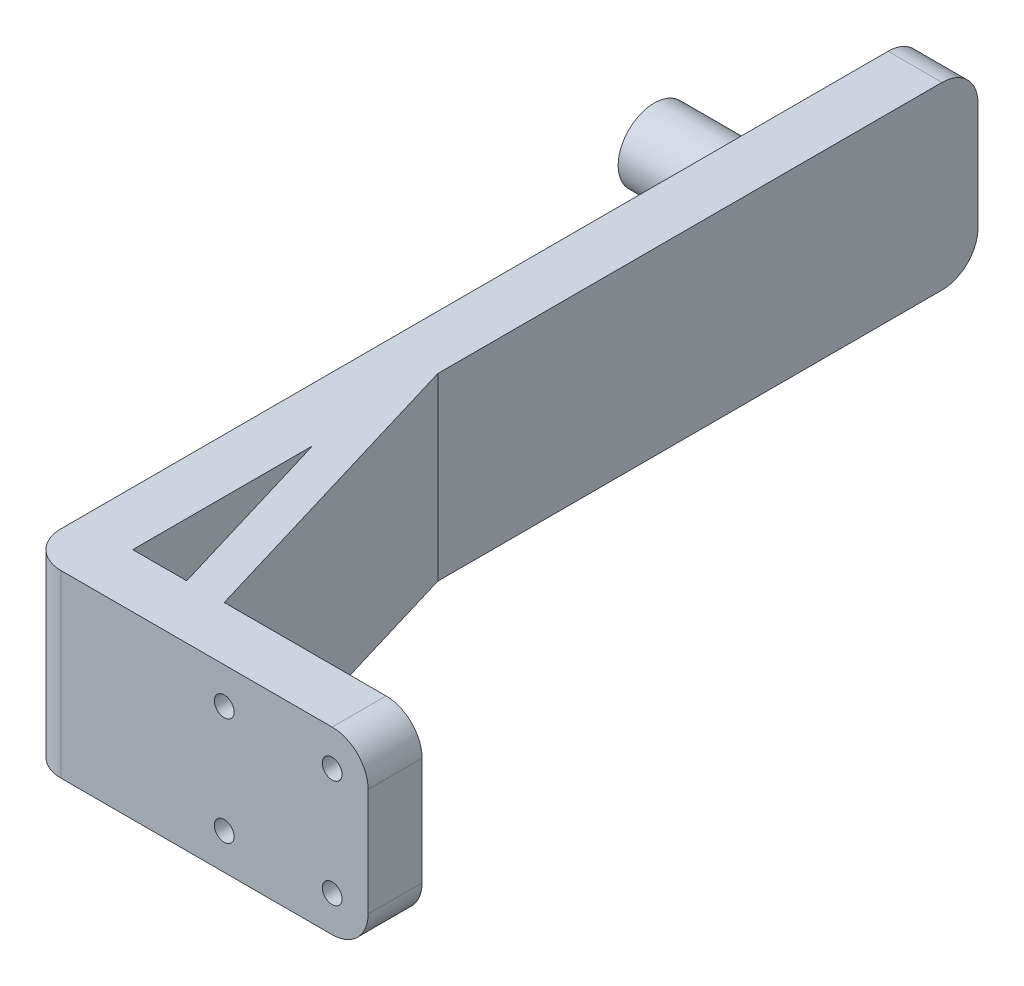
from build123d import *

# Parameters (mm, degrees)
BOSS_EXTRUDE1_DEPTH = 50
FILLET2_R           = 10
SKETCH18_R          = 12.5
BOSS_EXTRUDE2_DEPTH = 5
SKETCH19_R          = 10.05
BOSS_EXTRUDE3_DEPTH = 30
FILLET1_R           = 10


# Read off the part's stored shape, not the designer's step: M5 Clearance Hole3
with BuildPart() as part:
    # Sketch1 → Boss-Extrude1 (new body)
    with BuildSketch(Plane(origin=(0, 0, 0), x_dir=(1, 0, 0), z_dir=(0, 1, 0))):
        Polygon((15, 15), (15, 250), (0, 250), (0, 0), (95.440306509, 0), (95.440306509, 15), align=None)
        Polygon((40.440306509, 15), (15, 99.801021696), (15, 65), (30, 15), align=None)
    extrude(amount=BOSS_EXTRUDE1_DEPTH)

    # Fillet2
    fillet2_edges = [part.edges().sort_by_distance(p)[0] for p in [
        (0, 25, 0),
    ]]
    fillet(fillet2_edges, radius=FILLET2_R)

    # M5 Clearance Hole3 outline → M5 Clearance Hole3 (revolve, cut)
    with BuildSketch(Plane(origin=(55.440306509, 40, 0), x_dir=(1, 0, 0), z_dir=(0, -1, 0))):
        Polygon((2.75, -14.975), (2.75, 0), (0, 0), (0, -15), (2.775, -15), align=None)
    revolve(axis=Axis((55.440306509, 40, 0), (0, 0, 1)), mode=Mode.SUBTRACT)

    # M5 Clearance Hole3 2 outline → M5 Clearance Hole3 2 (revolve, cut)
    with BuildSketch(Plane(origin=(85.440306509, 10, 0), x_dir=(1, 0, 0), z_dir=(0, -1, 0))):
        Polygon((2.75, -14.975), (2.75, 0), (0, 0), (0, -15), (2.775, -15), align=None)
    revolve(axis=Axis((85.440306509, 10, 0), (0, 0, 1)), mode=Mode.SUBTRACT)

    # M5 Clearance Hole3 3 outline → M5 Clearance Hole3 3 (revolve, cut)
    with BuildSketch(Plane(origin=(55.440306509, 10, 0), x_dir=(1, 0, 0), z_dir=(0, -1, 0))):
        Polygon((2.75, -14.975), (2.75, 0), (0, 0), (0, -15), (2.775, -15), align=None)
    revolve(axis=Axis((55.440306509, 10, 0), (0, 0, 1)), mode=Mode.SUBTRACT)

    # M5 Clearance Hole3 4 outline → M5 Clearance Hole3 4 (revolve, cut)
    with BuildSketch(Plane(origin=(85.440306509, 40, 0), x_dir=(1, 0, 0), z_dir=(0, -1, 0))):
        Polygon((2.75, -14.975), (2.75, 0), (0, 0), (0, -15), (2.775, -15), align=None)
    revolve(axis=Axis((85.440306509, 40, 0), (0, 0, 1)), mode=Mode.SUBTRACT)

    # Sketch18 → Boss-Extrude2 (add)
    with BuildSketch(Plane.ZY):
        with Locations(Location((-210, 25, 0), (0, 0, 180))):
            Circle(SKETCH18_R)
    extrude(amount=BOSS_EXTRUDE2_DEPTH)

    # Sketch19 → Boss-Extrude3 (add)
    with BuildSketch(Plane.ZY.offset(5)):
        with Locations((-210, 25)):
            Circle(SKETCH19_R)
    extrude(amount=BOSS_EXTRUDE3_DEPTH)

    # Fillet1
    fillet1_edges = [part.edges().sort_by_distance(p)[0] for p in [
        (95.440306509, 0, -7.5),
        (7.5, 0, -250),
        (7.5, 50, -250),
        (95.440306509, 50, -7.5),
    ]]
    fillet(fillet1_edges, radius=FILLET1_R)


solid = part.part
